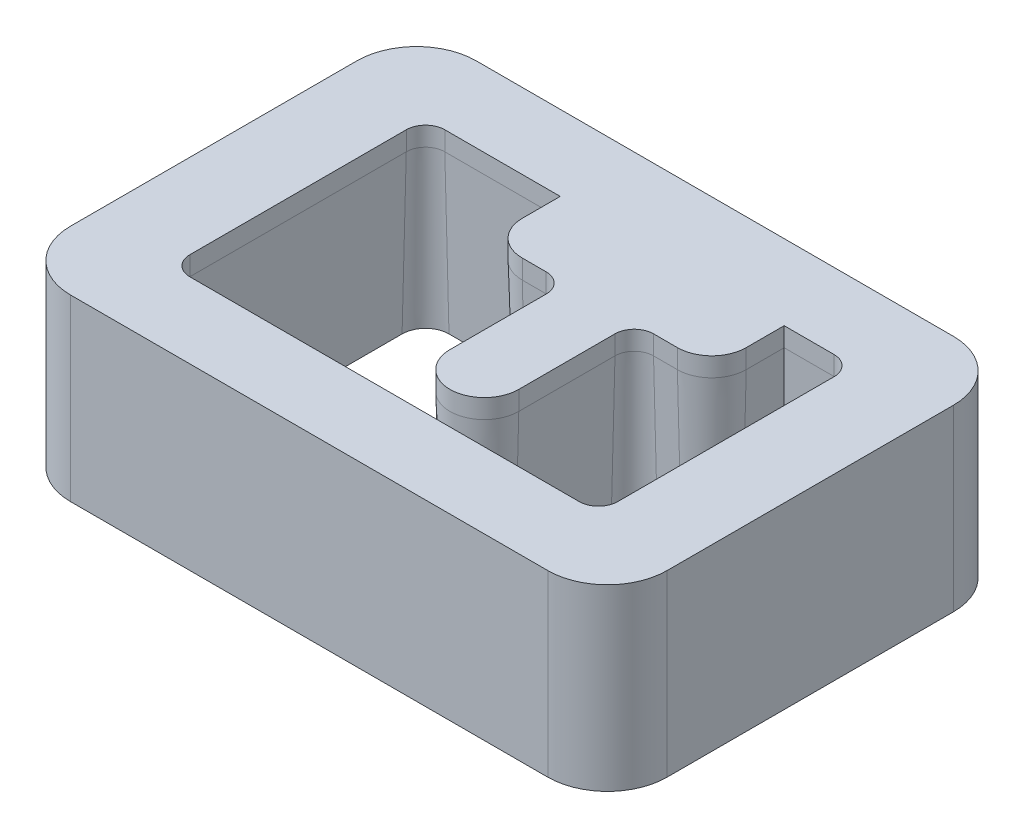
from build123d import *

# Parameters (mm, degrees)
SKETCH1_W                   = 100
SKETCH1_H                   = 68
BOSS_EXTRUDE1_DEPTH         = 30
FILLET1_R                   = 10
CUT_EXTRUDE1_REACH          = 69.498
M6_TAPPED_HOLE1_D           = 5
M6_TAPPED_HOLE1_DEPTH       = 17
M6_TAPPED_HOLE1_CSINK_D     = 6.05
M6_TAPPED_HOLE1_CSINK_ANGLE = 90
M6_TAPPED_HOLE1_TIP         = 1.502151548


with BuildPart() as part:
    # Sketch1 → Boss-Extrude1 (new body)
    with BuildSketch(Plane(origin=(0, 0, 0), x_dir=(1, 0, 0), z_dir=(0, 1, 0))):
        Rectangle(SKETCH1_W, SKETCH1_H)
    extrude(amount=-BOSS_EXTRUDE1_DEPTH)

    # Fillet1
    fillet1_edges = [part.edges().sort_by_distance(p)[0] for p in [
        (-50, -15, -34),
        (50, -15, -34),
        (50, -15, 34),
        (-50, -15, 34),
    ]]
    fillet(fillet1_edges, radius=FILLET1_R)

    # Sketch2 → Cut-Extrude1 (cut, up to next)
    with BuildSketch(Plane(origin=(0, 0, 0), x_dir=(1, 0, 0), z_dir=(0, 1, 0)), mode=Mode.PRIVATE) as cut_extrude1_sk1:
        with BuildLine():
            Line((-32.625, -21.36), (32.625, -21.36))
            ThreePointArc((32.625, -21.36), (34.908954903, -20.413954903), (35.855, -18.13))
            Line((35.855, -18.13), (35.855, 18.13))
            ThreePointArc((35.855, 18.13), (34.908954903, 20.413954903), (32.625, 21.36))
            Line((32.625, 21.36), (24.265, 21.36))
            Line((24.265, 21.36), (24.265, 15))
            ThreePointArc((24.265, 15), (22.575006127, 10.919993873), (18.495, 9.23))
            Line((18.495, 9.23), (14.495, 9.23))
            ThreePointArc((14.495, 9.23), (12.211045097, 8.283954903), (11.265, 6))
            Line((11.265, 6), (11.265, -10.13))
            ThreePointArc((11.265, -10.13), (5.495, -15.9), (-0.275, -10.13))
            Line((-0.275, -10.13), (-0.275, 6))
            ThreePointArc((-0.275, 6), (-1.221045097, 8.283954903), (-3.505, 9.23))
            Line((-3.505, 9.23), (-7.505, 9.23))
            ThreePointArc((-7.505, 9.23), (-11.585006127, 10.919993873), (-13.275, 15))
            Line((-13.275, 15), (-13.275, 21.36))
            Line((-13.275, 21.36), (-32.625, 21.36))
            ThreePointArc((-32.625, 21.36), (-34.908954903, 20.413954903), (-35.855, 18.13))
            Line((-35.855, 18.13), (-35.855, -18.13))
            ThreePointArc((-35.855, -18.13), (-34.908954903, -20.413954903), (-32.625, -21.36))
        make_face()
    cut_extrude1_tool1 = extrude(cut_extrude1_sk1.sketch, amount=-CUT_EXTRUDE1_REACH, mode=Mode.PRIVATE) & part.part
    add(cut_extrude1_tool1.solids().sort_by_distance((-1.698637, 0, 2.611892))[0], mode=Mode.SUBTRACT)

    # Cut-Sweep1: sweep along a path in Sketch5
    with BuildLine(Plane(origin=(0, 0, 0), x_dir=(1, 0, 0), z_dir=(0, 1, 0))) as cut_sweep1_path:
        Line((-32.625, -21.36), (32.625, -21.36))
        ThreePointArc((32.625, -21.36), (34.908954903, -20.413954903), (35.855, -18.13))
        Line((35.855, -18.13), (35.855, 18.13))
        ThreePointArc((35.855, 18.13), (34.908954903, 20.413954903), (32.625, 21.36))
        Line((32.625, 21.36), (24.265, 21.36))
        Line((24.265, 21.36), (24.265, 15))
        ThreePointArc((24.265, 15), (22.575006127, 10.919993873), (18.495, 9.23))
        Line((18.495, 9.23), (14.495, 9.23))
        ThreePointArc((14.495, 9.23), (12.211045097, 8.283954903), (11.265, 6))
        Line((11.265, 6), (11.265, -10.13))
        ThreePointArc((11.265, -10.13), (5.495, -15.9), (-0.275, -10.13))
        Line((-0.275, -10.13), (-0.275, 6))
        ThreePointArc((-0.275, 6), (-1.221045097, 8.283954903), (-3.505, 9.23))
        Line((-3.505, 9.23), (-7.505, 9.23))
        ThreePointArc((-7.505, 9.23), (-11.585006127, 10.919993873), (-13.275, 15))
        Line((-13.275, 15), (-13.275, 21.36))
        Line((-13.275, 21.36), (-32.625, 21.36))
        ThreePointArc((-32.625, 21.36), (-34.908954903, 20.413954903), (-35.855, 18.13))
        Line((-35.855, 18.13), (-35.855, -18.13))
        ThreePointArc((-35.855, -18.13), (-34.908954903, -20.413954903), (-32.625, -21.36))
    # Sketch3 → Cut-Sweep1 (sweep, cut)
    with BuildSketch(Plane.XY):
        Polygon((35.855, -3.2), (36.556782698, -30), (34.855, -30), (34.855, -3.2), align=None)
    sweep(path=cut_sweep1_path.line, transition=Transition.RIGHT, mode=Mode.SUBTRACT)

    # M6 Tapped Hole1
    with Locations(Plane(origin=(0, -30, 0), x_dir=(-1, 0, 0), z_dir=(0, -1, 0))):
        with Locations((-43, 27), (43, 27), (43, -27), (-43, -27)):
            CounterSinkHole(M6_TAPPED_HOLE1_D / 2, M6_TAPPED_HOLE1_CSINK_D / 2, depth=M6_TAPPED_HOLE1_DEPTH, counter_sink_angle=M6_TAPPED_HOLE1_CSINK_ANGLE)
            with Locations((0, 0, -(M6_TAPPED_HOLE1_DEPTH + M6_TAPPED_HOLE1_TIP / 2))):  # 118° drill point
                Cone(0, M6_TAPPED_HOLE1_D / 2, M6_TAPPED_HOLE1_TIP, mode=Mode.SUBTRACT)


solid = part.part
